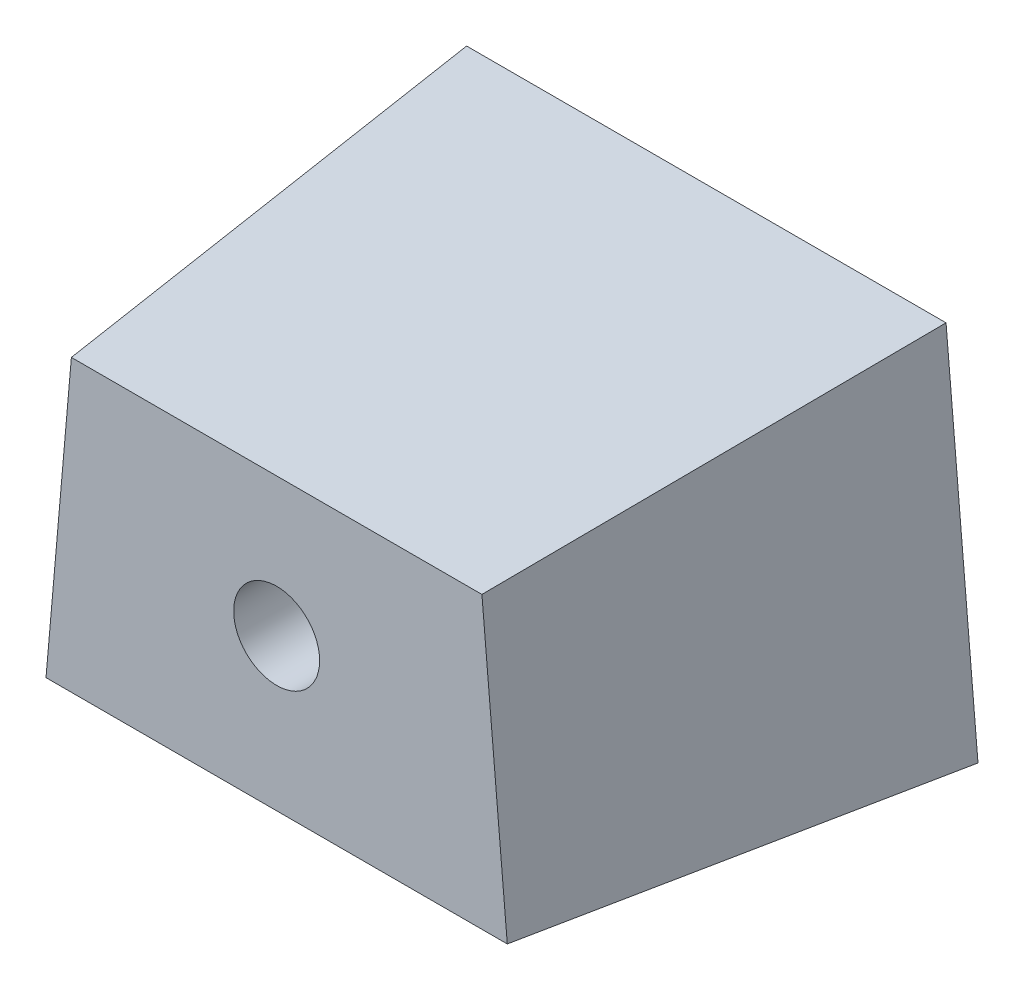
from build123d import *

# Parameters (mm, degrees)
Y_KSEKLIK_EKSTR_ZYON1_DEPTH = 40
Y_KSEKLIK_EKSTR_ZYON1_TAPER = 5
IZIM2_R                     = 4
KES_EKSTR_ZYON1_DEPTH       = 8
KES_EKSTR_ZYON2_DEPTH       = 50
KES_EKSTR_ZYON2_TAPER       = -5
KES_EKSTR_ZYON3_START       = -5
IZIM4_R                     = 4
KES_EKSTR_ZYON3_DEPTH       = 5


with BuildPart() as part:
    # Çizim1 → Yükseklik-Ekstrüzyon1 (new body)
    with BuildSketch(Plane.XY):
        Polygon((-22, 20), (-25.5, -20.00518306), (25.5, -20.00518306), (22, 20), align=None)
    extrude(amount=Y_KSEKLIK_EKSTR_ZYON1_DEPTH, taper=Y_KSEKLIK_EKSTR_ZYON1_TAPER)

    # Çizim2 → Kes-Ekstrüzyon1 (cut)
    with BuildSketch(Plane.XY.offset(40)):
        Circle(IZIM2_R)
    extrude(amount=-KES_EKSTR_ZYON1_DEPTH, mode=Mode.SUBTRACT)

    # Çizim3 → Kes-Ekstrüzyon2 (cut)
    with BuildSketch(Plane(origin=(0, 0, 0), x_dir=(-1, 0, 0), z_dir=(0, 0, -1))):
        Polygon((22.315530307, 16.393472084), (22, 20), (-22, 20), (-22.315530307, 16.393472084), align=None)
        Polygon((25.290144867, -17.606527916), (-25.290144867, -17.606527916), (-25.5, -20.00518306), (25.5, -20.00518306), align=None)
    extrude(amount=-KES_EKSTR_ZYON2_DEPTH, taper=KES_EKSTR_ZYON2_TAPER, mode=Mode.SUBTRACT)

    # Çizim4 → Kes-Ekstrüzyon3 (cut)
    with BuildSketch(Plane(origin=(0, 0, 0), x_dir=(-1, 0, 0), z_dir=(0, 0, -1)).offset(KES_EKSTR_ZYON3_START)):
        Circle(IZIM4_R)
    extrude(amount=KES_EKSTR_ZYON3_DEPTH, mode=Mode.SUBTRACT)


solid = part.part
